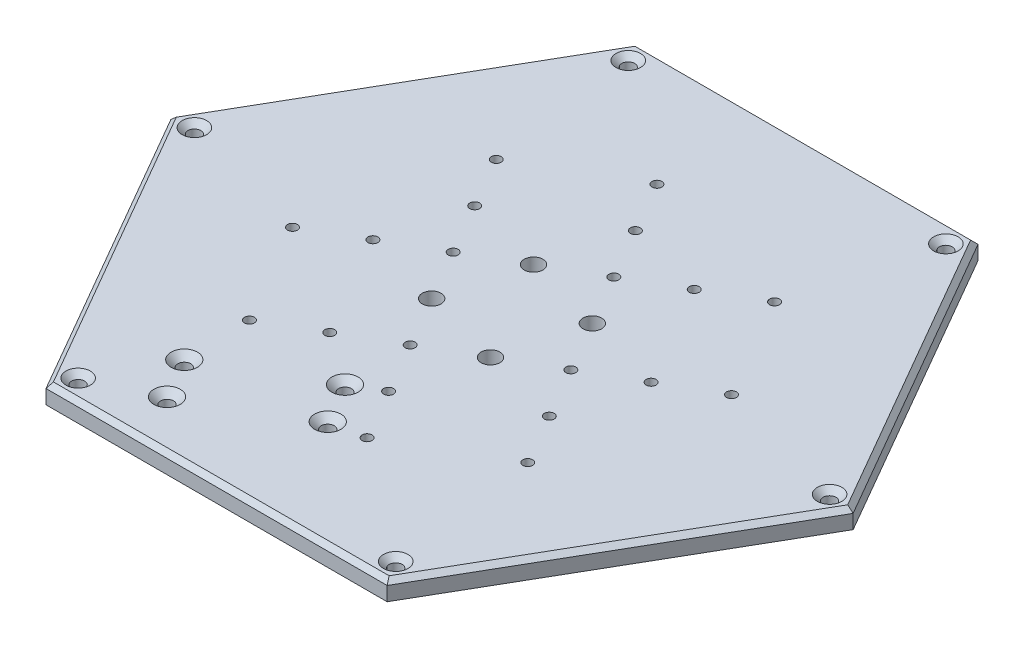
from build123d import *

# Parameters (mm, degrees)
BOSS_EXTRUDE1_DEPTH                             = 8
CSK_FOR_M5_FLAT_HEAD_MACHINE_SCREW2_D           = 5.5
CSK_FOR_M5_FLAT_HEAD_MACHINE_SCREW2_DEPTH       = 10
CSK_FOR_M5_FLAT_HEAD_MACHINE_SCREW2_CSINK_D     = 10.4
CSK_FOR_M5_FLAT_HEAD_MACHINE_SCREW2_CSINK_ANGLE = 90
CSK_FOR_M5_FLAT_HEAD_MACHINE_SCREW2_TIP         = 1.652366702
CSK_FOR_M5_SFHCS1_D                             = 5.5
CSK_FOR_M5_SFHCS1_DEPTH                         = 10
CSK_FOR_M5_SFHCS1_CSINK_D                       = 11.2
CSK_FOR_M5_SFHCS1_CSINK_ANGLE                   = 90
CSK_FOR_M5_SFHCS1_TIP                           = 1.652366702
M5X0_8_TAPPED_HOLE1_D                           = 4.2
F_3_8_16_TAPPED_HOLE3_D                         = 7.9375
CHAMFER4_SIZE                                   = 2


with BuildPart() as part:
    # Sketch1 → Boss-Extrude1 (new body)
    with BuildSketch(Plane(origin=(0, 0, 0), x_dir=(1, 0, 0), z_dir=(0, 1, 0))):
        Polygon((72.5, 125.573683549), (-72.5, 125.573683549), (-145, 0), (-72.5, -125.573683549), (72.5, -125.573683549), (145, 0), align=None)
    extrude(amount=BOSS_EXTRUDE1_DEPTH)

    # CSK for M5 Flat Head Machine Screw2
    with Locations(Plane(origin=(0, 8, 0), x_dir=(1, 0, 0), z_dir=(0, 1, 0))):
        with Locations((-135, 0), (-67.5, -116.913429511), (67.5, -116.913429511), (135, 0), (67.5, 116.913429511), (-67.5, 116.913429511)):
            CounterSinkHole(CSK_FOR_M5_FLAT_HEAD_MACHINE_SCREW2_D / 2, CSK_FOR_M5_FLAT_HEAD_MACHINE_SCREW2_CSINK_D / 2, depth=CSK_FOR_M5_FLAT_HEAD_MACHINE_SCREW2_DEPTH, counter_sink_angle=CSK_FOR_M5_FLAT_HEAD_MACHINE_SCREW2_CSINK_ANGLE)
            with Locations((0, 0, -(CSK_FOR_M5_FLAT_HEAD_MACHINE_SCREW2_DEPTH + CSK_FOR_M5_FLAT_HEAD_MACHINE_SCREW2_TIP / 2))):  # 118° drill point
                Cone(0, CSK_FOR_M5_FLAT_HEAD_MACHINE_SCREW2_D / 2, CSK_FOR_M5_FLAT_HEAD_MACHINE_SCREW2_TIP, mode=Mode.SUBTRACT)

    # CSK for M5 SFHCS1
    with Locations(Plane(origin=(0, 8, 0), x_dir=(1, 0, 0), z_dir=(0, 1, 0))):
        with Locations((1.594210129, -79.908620039), (-8.405789871, -62.588111964), (-51.70706006, -87.588111964), (-41.70706006, -104.908620039)):
            CounterSinkHole(CSK_FOR_M5_SFHCS1_D / 2, CSK_FOR_M5_SFHCS1_CSINK_D / 2, depth=CSK_FOR_M5_SFHCS1_DEPTH, counter_sink_angle=CSK_FOR_M5_SFHCS1_CSINK_ANGLE)
            with Locations((0, 0, -(CSK_FOR_M5_SFHCS1_DEPTH + CSK_FOR_M5_SFHCS1_TIP / 2))):  # 118° drill point
                Cone(0, CSK_FOR_M5_SFHCS1_D / 2, CSK_FOR_M5_SFHCS1_TIP, mode=Mode.SUBTRACT)

    # M5x0.8 Tapped Hole1 (through all)
    with Locations(Plane(origin=(0, 8, 0), x_dir=(1, 0, 0), z_dir=(0, 1, 0))):
        with Locations((59.150635095, -52.451905284), (15.849364905, -77.451905284), (3.349364905, -55.801270189), (46.650635095, -30.801270189), (34.150635095, -9.150635095), (9.150635095, 34.150635095), (-34.150635095, 9.150635095), (-9.150635095, -34.150635095), (-30.801270189, -46.650635095), (-52.451905284, -59.150635095), (-77.451905284, -15.849364905), (-55.801270189, -3.349364905), (-46.650635095, 30.801270189), (-59.150635095, 52.451905284), (-15.849364905, 77.451905284), (-3.349364905, 55.801270189), (30.801270189, 46.650635095), (55.801270189, 3.349364905), (77.451905284, 15.849364905), (52.451905284, 59.150635095)):
            Hole(M5X0_8_TAPPED_HOLE1_D / 2)

    # 3/8-16 Tapped Hole3 (through all)
    with Locations(Plane(origin=(0, 8, 0), x_dir=(1, 0, 0), z_dir=(0, 1, 0))):
        with Locations((12.5, -21.650635095), (-21.650635095, -12.5), (-12.5, 21.650635095), (21.650635095, 12.5)):
            Hole(F_3_8_16_TAPPED_HOLE3_D / 2)

    # Chamfer4
    chamfer4_edges = [part.edges().sort_by_distance(p)[0] for p in [
        (0, 8, 125.573683549),
        (108.75, 8, 62.786841774),
        (108.75, 8, -62.786841774),
        (0, 8, -125.573683549),
        (-108.75, 8, -62.786841774),
        (-108.75, 8, 62.786841774),
    ]]
    chamfer(chamfer4_edges, length=CHAMFER4_SIZE)


solid = part.part
